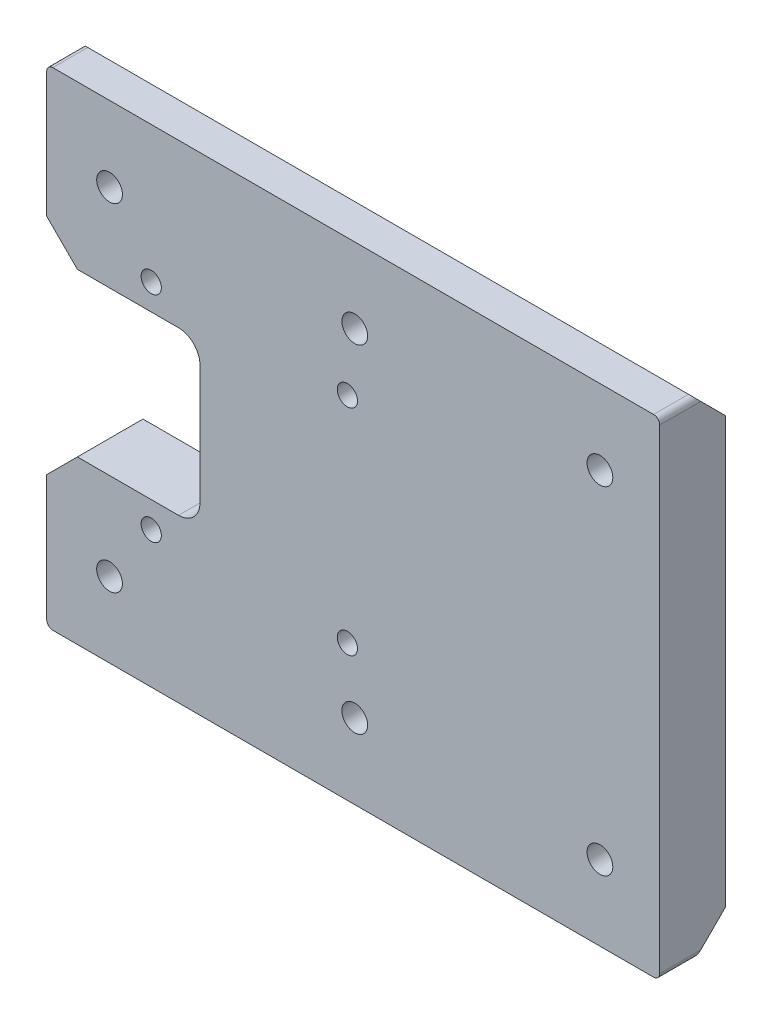
from build123d import *

# Parameters (mm, degrees)
BOSS_EXTRUDE1_DEPTH         = 12.7
CHAMFER1_SIZE               = 5
FILLET1_R                   = 3.5
TAP_DRILL_FOR_M5X0_8_TAP1_D = 4.2
CUT_EXTRUDE1_DEPTH          = 2
CHAMFER3_SIZE               = 5
TAP_DRILL_FOR_M4X0_7_TAP1_D = 3.3
CUT_EXTRUDE2_DEPTH          = 2


with BuildPart() as part:
    # Sketch1 → Boss-Extrude1 (new body)
    with BuildSketch(Plane.XY):
        with BuildLine():
            Line((0, 38.75), (0, 13.25))
            Line((0, 13.25), (25, 13.25))
            Line((25, 13.25), (25, -13.25))
            Line((25, -13.25), (0, -13.25))
            Line((0, -13.25), (0, -38.75))
            ThreePointArc((0, -38.75), (0.292893219, -39.457106781), (1, -39.75))
            Line((1, -39.75), (99, -39.75))
            ThreePointArc((99, -39.75), (99.707106781, -39.457106781), (100, -38.75))
            Line((100, -38.75), (100, 38.75))
            ThreePointArc((100, 38.75), (99.707106781, 39.457106781), (99, 39.75))
            Line((99, 39.75), (1, 39.75))
            ThreePointArc((1, 39.75), (0.292893219, 39.457106781), (0, 38.75))
        make_face()
    extrude(amount=BOSS_EXTRUDE1_DEPTH)

    # Chamfer1
    chamfer1_edges = [part.edges().sort_by_distance(p)[0] for p in [
        (0, 13.25, 6.35),
        (0, -13.25, 6.35),
    ]]
    chamfer(chamfer1_edges, length=CHAMFER1_SIZE)

    # Fillet1
    fillet1_edges = [part.edges().sort_by_distance(p)[0] for p in [
        (25, -13.25, 6.35),
        (25, 13.25, 6.35),
    ]]
    fillet(fillet1_edges, radius=FILLET1_R)

    # Tap Drill for M5x0.8 Tap1 (through all)
    with Locations(Plane.XY.offset(12.7)):
        with Locations((10.25, 27.5), (50.25, 27.5), (90.25, 27.5), (90.25, -27.5), (50.25, -27.5), (10.25, -27.5)):
            Hole(TAP_DRILL_FOR_M5X0_8_TAP1_D / 2)

    # Sketch8 → Cut-Extrude1 (cut)
    with BuildSketch(Plane(origin=(0, 0, 0), x_dir=(-1, 0, 0), z_dir=(0, 0, -1))):
        with BuildLine():
            Line((-21.5, 13.25), (-5, 13.25))
            Line((-5, 13.25), (0, 18.25))
            Line((0, 18.25), (0, 38.75))
            ThreePointArc((0, 38.75), (-0.292893219, 39.457106781), (-1, 39.75))
            Line((-1, 39.75), (-99, 39.75))
            ThreePointArc((-99, 39.75), (-99.707106781, 39.457106781), (-100, 38.75))
            Line((-100, 38.75), (-100, -38.75))
            ThreePointArc((-100, -38.75), (-99.707106781, -39.457106781), (-99, -39.75))
            Line((-99, -39.75), (-1, -39.75))
            ThreePointArc((-1, -39.75), (-0.292893219, -39.457106781), (0, -38.75))
            Line((0, -38.75), (0, -18.25))
            Line((0, -18.25), (-5, -13.25))
            Line((-5, -13.25), (-21.5, -13.25))
            ThreePointArc((-21.5, -13.25), (-23.974873734, -12.224873734), (-25, -9.75))
            Line((-25, -9.75), (-25, 9.75))
            ThreePointArc((-25, 9.75), (-23.974873734, 12.224873734), (-21.5, 13.25))
        make_face()
        with BuildLine():
            Line((-84, -12.5), (-41, -12.5))
            ThreePointArc((-41, -12.5), (-38.525126266, -11.474873734), (-37.5, -9))
            Line((-37.5, -9), (-37.5, 9))
            ThreePointArc((-37.5, 9), (-38.525126266, 11.474873734), (-41, 12.5))
            Line((-41, 12.5), (-84, 12.5))
            ThreePointArc((-84, 12.5), (-86.474873734, 11.474873734), (-87.5, 9))
            Line((-87.5, 9), (-87.5, -9))
            ThreePointArc((-87.5, -9), (-86.474873734, -11.474873734), (-84, -12.5))
        make_face(mode=Mode.SUBTRACT)
    extrude(amount=-CUT_EXTRUDE1_DEPTH, mode=Mode.SUBTRACT)

    # Chamfer3
    # the kernel refuses this chamfer: 5 mm, written as the material it takes off along each edge
    with BuildSketch(Plane(origin=(111.85841494, -39.75, 2), x_dir=(0, 0.9996219169112968, -0.02749587661058636), z_dir=(-1, 0, 0)), Plane(origin=(-11.85841494, 39.75, 2), x_dir=(0, -0.9996219169112968, -0.02749587661058636), z_dir=(1, 0, 0))) as chamfer3_piece_1:
        Polygon((CHAMFER3_SIZE * 0.999621916911, -CHAMFER3_SIZE * 0.0274958766106), (-CHAMFER3_SIZE * 0.0274958766106, -CHAMFER3_SIZE * 0.999621916911), (0, 0), align=None)
    extrude(amount=123.71682988, mode=Mode.SUBTRACT)

    # Tap Drill for M4x0.7 Tap1 (through all)
    with Locations(Plane.XY.offset(12.7)):
        with Locations((17.05, 17.5), (17.05, -17.5), (49.05, -17.5), (49.05, 17.5)):
            Hole(TAP_DRILL_FOR_M4X0_7_TAP1_D / 2)

    # Sketch11 → Cut-Extrude2 (cut)
    with BuildSketch(Plane(origin=(0, 0, 0), x_dir=(-1, 0, 0), z_dir=(0, 0, -1))):
        with BuildLine():
            Line((-37.5, -9), (-37.5, 9))
            ThreePointArc((-37.5, 9), (-38.525126266, 11.474873734), (-41, 12.5))
            Line((-41, 12.5), (-84, 12.5))
            ThreePointArc((-84, 12.5), (-86.474873734, 11.474873734), (-87.5, 9))
            Line((-87.5, 9), (-87.5, -9))
            ThreePointArc((-87.5, -9), (-86.474873734, -11.474873734), (-84, -12.5))
            Line((-84, -12.5), (-41, -12.5))
            ThreePointArc((-41, -12.5), (-38.525126266, -11.474873734), (-37.5, -9))
        make_face()
    extrude(amount=-CUT_EXTRUDE2_DEPTH, mode=Mode.SUBTRACT)


solid = part.part
